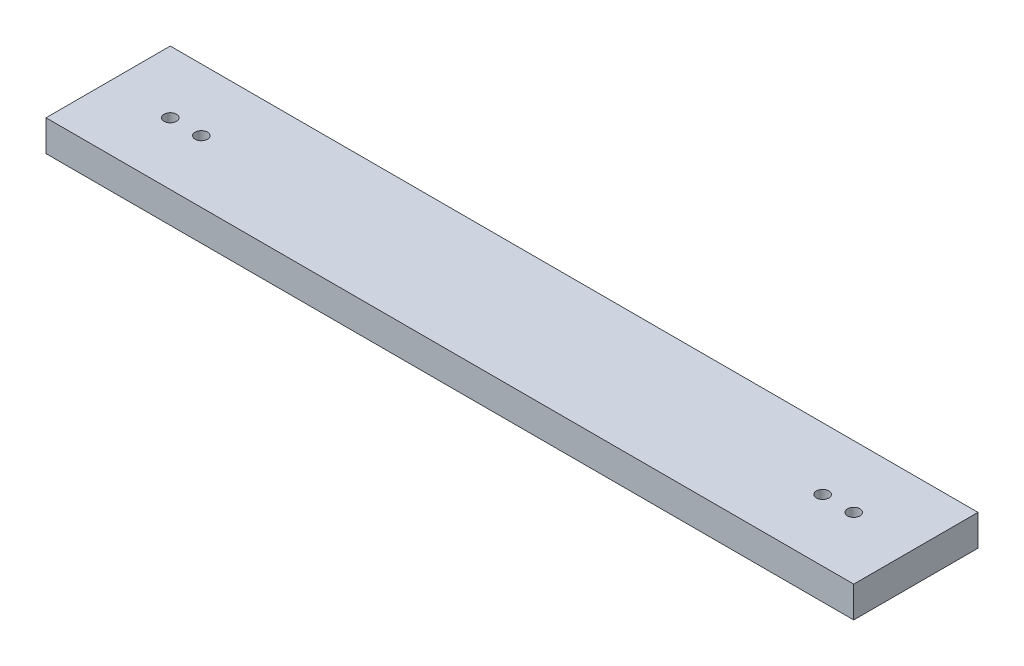
from build123d import *

# Parameters (mm, degrees)
SKETCH3_W           = 520
SKETCH3_H           = 80
BOSS_EXTRUDE1_DEPTH = 20
SKETCH4_R           = 4
CUT_EXTRUDE1_DEPTH  = 527.497863244


with BuildPart() as part:
    # Sketch3 → Boss-Extrude1 (new body)
    with BuildSketch(Plane(origin=(0, 0, 0), x_dir=(1, 0, 0), z_dir=(0, 1, 0))):
        with Locations((260, 40)):
            Rectangle(SKETCH3_W, SKETCH3_H)
    extrude(amount=BOSS_EXTRUDE1_DEPTH)

    # Sketch4 → Cut-Extrude1 (cut, through all)
    with BuildSketch(Plane(origin=(0, 20, 0), x_dir=(1, 0, 0), z_dir=(0, 1, 0))):
        with Locations((40, 40)):
            Circle(SKETCH4_R)
        with Locations((60, 40)):
            Circle(SKETCH4_R)
        with Locations((460, 40)):
            Circle(SKETCH4_R)
        with Locations((480, 40)):
            Circle(SKETCH4_R)
    extrude(amount=-CUT_EXTRUDE1_DEPTH, mode=Mode.SUBTRACT)


solid = part.part
